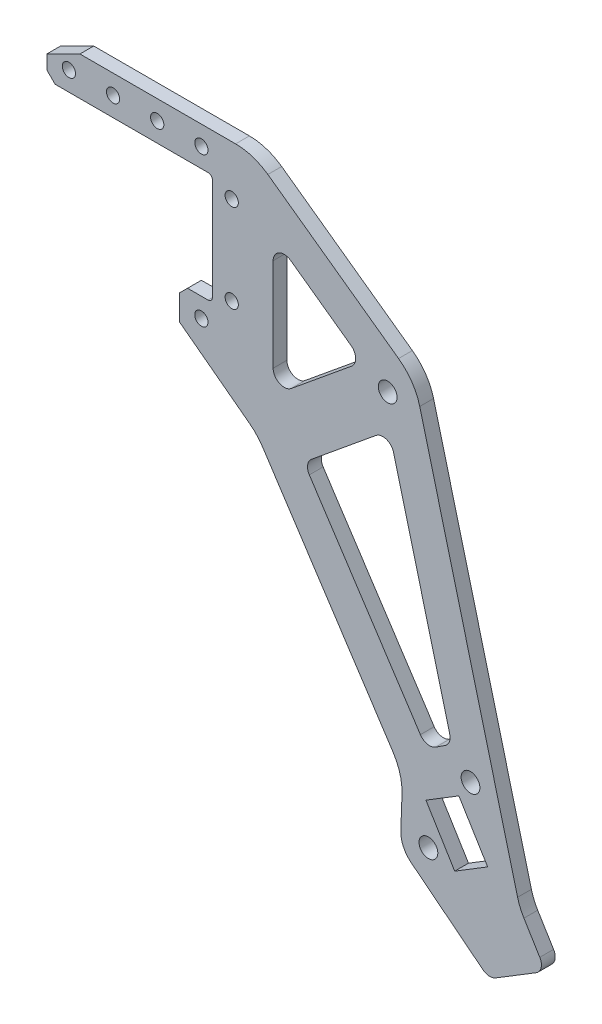
from build123d import *
from OCP.BRepFilletAPI import BRepFilletAPI_MakeFillet

# Parameters (mm, degrees)
BOSS_EXTRU_1_DEPTH      = 2.5
D_GAGEMENT_M21_D        = 2.4
CHANFREIN1_SIZE         = 1.5
CHANFREIN2_SIZE         = 6
CHANFREIN2_SIZE2        = 3
CONG_1_R                = 2
CONG_2_R1               = 10
CONG_2_R2               = 5
CONG_3_R                = 0.8
D_GAGEMENT_M31_D        = 3.4
ENL_V_MAT_EXTRU_1_REACH = 117.655


with BuildPart() as part:
    # Esquisse1 → Boss.-Extru.1 (new body)
    with BuildSketch(Plane.XY):
        Polygon((-17.75, 10), (12.25, 10), (12.25, -10), (6.25, -10), (6.25, -16), (20.391821523, -26.665834049), (46.71123265, -66.806693506), (46.285412403, -78.306693506), (62.357629227, -91.032016541), (72.595795313, -84.772627178), (67.901253291, -77.094002614), (48.900602827, -4.024), (19.677471167, 17), (-17.75, 17), align=None)
        Polygon((23.25, 5.973778988), (39.485073144, -5.706221012), (23.25, -19.026221012), align=None, mode=Mode.SUBTRACT)
        Polygon((28.816069815, -26.747772307), (44.278044238, -14.062058021), (55.602935243, -57.613715208), (51.023072953, -60.616622474), align=None, mode=Mode.SUBTRACT)
    extrude(amount=BOSS_EXTRU_1_DEPTH)

    # Dégagement M21 (through all)
    with Locations(Plane.XY.offset(2.5)):
        with Locations((-13.75, 13.5), (-5.75, 13.5), (2.25, 13.5), (10.25, 13.5), (15.75, 8), (15.75, -8), (10.25, -13.5)):
            Hole(D_GAGEMENT_M21_D / 2)

    # Chanfrein1
    chanfrein1_edges = [part.edges().sort_by_distance(p)[0] for p in [
        (6.25, -10, 1.25),
        (-17.75, 10, 1.25),
    ]]
    chamfer(chanfrein1_edges, length=CHANFREIN1_SIZE)

    # Chanfrein2
    chanfrein2_edges = [part.edges().sort_by_distance(p)[0] for p in [
        (-17.75, 17, 1.25),
    ]]
    chanfrein2_side = [part.faces().sort_by_distance(p)[0] for p in [
        (0.963735584, 17, 1.25),
    ]]
    chamfer(chanfrein2_edges, length=CHANFREIN2_SIZE, length2=CHANFREIN2_SIZE2, reference=chanfrein2_side[0])

    # Congé1
    cong_1_edges = [part.edges().sort_by_distance(p)[0] for p in [
        (55.602935243, -57.613715208, 1.25),
        (51.023072953, -60.616622474, 1.25),
        (28.816069815, -26.747772307, 1.25),
        (44.278044238, -14.062058021, 1.25),
        (39.485073144, -5.706221012, 1.25),
        (23.25, -19.026221012, 1.25),
        (23.25, 5.973778988, 1.25),
        (62.357629227, -91.032016541, 1.25),
        (72.595795313, -84.772627178, 1.25),
    ]]
    fillet(cong_1_edges, radius=CONG_1_R)

    # Congé2: one fillet with a radius per group of edges: ONE call of the kernel's fillet builder (fillet() takes one radius for all edges)
    cong_2_edges_1 = [part.edges().sort_by_distance(p)[0] for p in [
        (19.677471167, 17, 1.25),
        (48.900602827, -4.024, 1.25),
        (20.391821523, -26.665834049, 1.25),
        (46.71123265, -66.806693506, 1.25),
        (67.901253291, -77.094002614, 1.25),
    ]]
    cong_2_edges_2 = [part.edges().sort_by_distance(p)[0] for p in [
        (46.285412403, -78.306693506, 1.25),
    ]]
    cong_2 = BRepFilletAPI_MakeFillet(part.part.solid().wrapped)
    for e in cong_2_edges_1:
        cong_2.Add(CONG_2_R1, e.wrapped)
    for e in cong_2_edges_2:
        cong_2.Add(CONG_2_R2, e.wrapped)
    add(Compound.cast(cong_2.Shape()), mode=Mode.REPLACE)

    # Congé3
    cong_3_edges = [part.edges().sort_by_distance(p)[0] for p in [
        (12.25, -10, 1.25),
        (12.25, 10, 1.25),
    ]]
    fillet(cong_3_edges, radius=CONG_3_R)

    # Dégagement M31 (through all)
    with Locations(Plane(origin=(0, 0, 0), x_dir=(-1, 0, 0), z_dir=(0, 0, -1))):
        with Locations((-44, -8.146072926), (-59, -61.892892977), (-51.375748619, -75.959548261)):
            Hole(D_GAGEMENT_M31_D / 2)

    # Esquisse6 → Enlèv. mat.-Extru.1 (cut, up to next)
    with BuildSketch(Plane.XY.offset(2.5), mode=Mode.PRIVATE) as enl_v_mat_extru_1_sk1:
        Polygon((50.923621455, -68.720394376), (56.895885005, -65.069083914), (62.112042808, -73.600888985), (56.139779258, -77.252199447), align=None)
    enl_v_mat_extru_1_tool1 = extrude(enl_v_mat_extru_1_sk1.sketch, amount=-ENL_V_MAT_EXTRU_1_REACH, mode=Mode.PRIVATE) & part.part
    add(enl_v_mat_extru_1_tool1.solids().sort_by_distance((56.517832, -71.160642, 2.5))[0], mode=Mode.SUBTRACT)


solid = part.part
